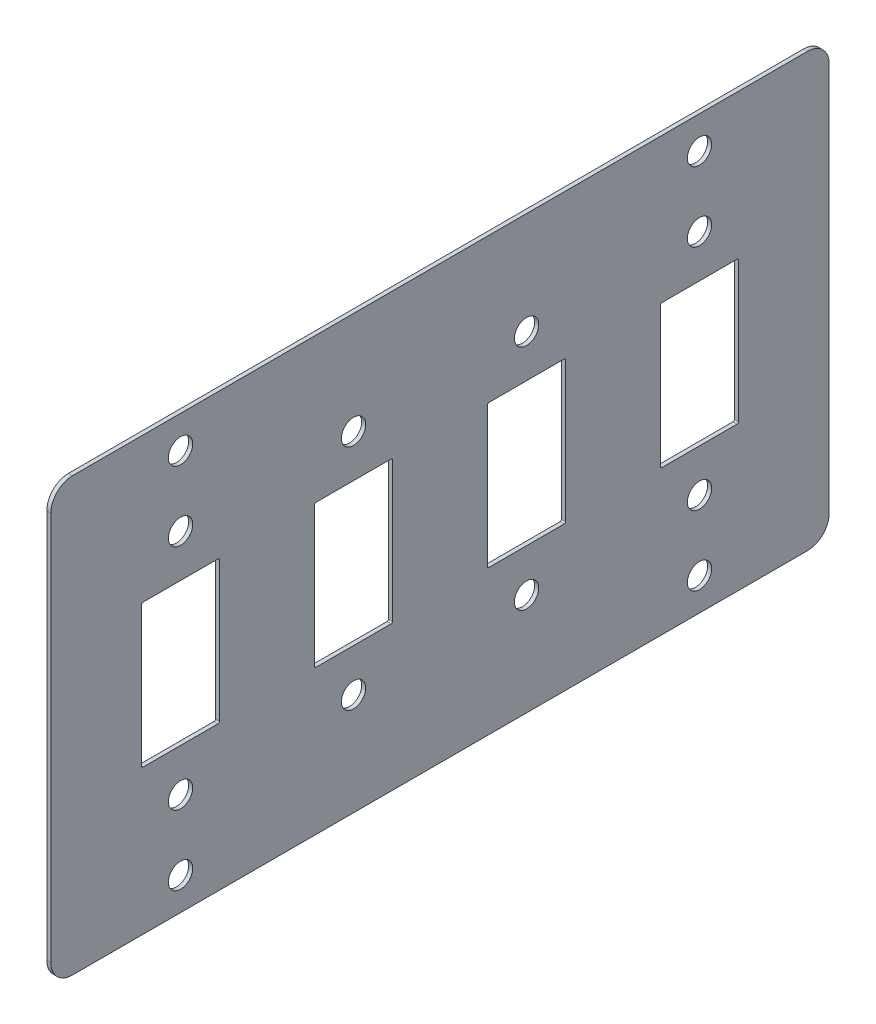
from build123d import *

# Parameters (mm, degrees)
SKETCH1_W               = 228.6
SKETCH1_H               = 127
BASE_FLANGE1_DEPTH      = 1.1938
CUT_EXTRUDE1_REACH      = 132.76
SKETCH6_R               = 3.571875
SKETCH6_W               = 22.89175
SKETCH6_H               = 41.94175
LPATTERN1_COUNT         = 4
LPATTERN1_PITCH         = 50.8
CUT_EXTRUDE2_REACH      = 132.76
SKETCH7_R               = 3.571875
MIRROR2_COPY_1_REACH    = 132.76
MIRROR2_COPY_1_SKETCH_R = 3.571875
FILLET1_R               = 6.35
FILLET2_R               = 0.396875


# Sheet-metal steps are written as plain solids
with BuildPart() as part:
    # Sketch1 → Base-Flange1 (new body)
    with BuildSketch(Plane(origin=(0, 0, 0), x_dir=(0, 0, -1), z_dir=(1, 0, 0))):
        Rectangle(SKETCH1_W, SKETCH1_H)
    extrude(amount=-BASE_FLANGE1_DEPTH)

    # Sketch6 → Cut-Extrude1 (cut, up to next)
    with BuildSketch(Plane(origin=(0, 0, 0), x_dir=(0, 0, -1), z_dir=(1, 0, 0)), mode=Mode.PRIVATE) as cut_extrude1_sk1:
        with Locations((-76.2, 33.5026)):
            Circle(SKETCH6_R)
    cut_extrude1_tool1 = extrude(cut_extrude1_sk1.sketch, amount=-CUT_EXTRUDE1_REACH, mode=Mode.PRIVATE) & part.part
    # Sketch6 → Cut-Extrude1 (cut, up to next)
    with BuildSketch(Plane(origin=(0, 0, 0), x_dir=(0, 0, -1), z_dir=(1, 0, 0)), mode=Mode.PRIVATE) as cut_extrude1_sk2:
        with Locations((-76.2, -33.5026)):
            Circle(SKETCH6_R)
    cut_extrude1_tool2 = extrude(cut_extrude1_sk2.sketch, amount=-CUT_EXTRUDE1_REACH, mode=Mode.PRIVATE) & part.part
    # Sketch6 → Cut-Extrude1 (cut, up to next)
    with BuildSketch(Plane(origin=(0, 0, 0), x_dir=(0, 0, -1), z_dir=(1, 0, 0)), mode=Mode.PRIVATE) as cut_extrude1_sk3:
        with Locations((-76.2, 0)):
            Rectangle(SKETCH6_W, SKETCH6_H)
    cut_extrude1_tool3 = extrude(cut_extrude1_sk3.sketch, amount=-CUT_EXTRUDE1_REACH, mode=Mode.PRIVATE) & part.part
    cut_extrude1_1 = cut_extrude1_tool1.solids().sort_by_distance((0, 33.5026, 76.2))[0]
    add(cut_extrude1_1, mode=Mode.SUBTRACT)
    cut_extrude1_2 = cut_extrude1_tool2.solids().sort_by_distance((0, -33.5026, 76.2))[0]
    add(cut_extrude1_2, mode=Mode.SUBTRACT)
    cut_extrude1_3 = cut_extrude1_tool3.solids().sort_by_distance((0, 0, 76.2))[0]
    add(cut_extrude1_3, mode=Mode.SUBTRACT)
    cut_extrude1 = cut_extrude1_1 + cut_extrude1_2 + cut_extrude1_3  # Cut-Extrude1 as one shape, for the pattern or mirror that repeats it

    # LPattern1: Cut-Extrude1 ×4
    with Locations(*[(0, 0, -i * LPATTERN1_PITCH) for i in range(1, LPATTERN1_COUNT)]):
        add(cut_extrude1, mode=Mode.SUBTRACT)

    # Sketch7 → Cut-Extrude2 (cut, up to next)
    with BuildSketch(Plane(origin=(0, 0, 0), x_dir=(0, 0, -1), z_dir=(1, 0, 0)), mode=Mode.PRIVATE) as cut_extrude2_sk1:
        with Locations((-76.2, 53.975)):
            Circle(SKETCH7_R)
    cut_extrude2_tool1 = extrude(cut_extrude2_sk1.sketch, amount=-CUT_EXTRUDE2_REACH, mode=Mode.PRIVATE) & part.part
    cut_extrude2 = cut_extrude2_tool1.solids().sort_by_distance((0, 53.975, 76.2))[0]
    add(cut_extrude2, mode=Mode.SUBTRACT)

    # Mirror1: Cut-Extrude2 across plane
    add(cut_extrude2.mirror(Plane.XY), mode=Mode.SUBTRACT)

    # Mirror2: Cut-Extrude2 across plane
    add(cut_extrude2.mirror(Plane.ZX), mode=Mode.SUBTRACT)

    # Mirror2 copy 1 sketch → Mirror2 copy 1 (cut, up to next)
    with BuildSketch(Plane(origin=(0, 0, 0), x_dir=(0, 0, 1), z_dir=(1, 0, 0)), mode=Mode.PRIVATE) as mirror2_copy_1_sk1:
        with Locations((-76.2, 53.975)):
            Circle(MIRROR2_COPY_1_SKETCH_R)
    mirror2_copy_1_tool1 = extrude(mirror2_copy_1_sk1.sketch, amount=-MIRROR2_COPY_1_REACH, mode=Mode.PRIVATE) & part.part
    add(mirror2_copy_1_tool1.solids().sort_by_distance((0, -53.975, -76.2))[0], mode=Mode.SUBTRACT)

    # Fillet1
    fillet1_edges = [part.edges().sort_by_distance(p)[0] for p in [
        (-0.5969, 63.5, 114.3),
        (-0.5969, 63.5, -114.3),
        (-0.5969, -63.5, -114.3),
        (-0.5969, -63.5, 114.3),
    ]]
    fillet(fillet1_edges, radius=FILLET1_R)

    # Fillet2
    fillet2_edges = [part.edges().sort_by_distance(p)[0] for p in [
        (-0.5969, 20.970875, 64.754125),
        (-0.5969, -20.970875, 64.754125),
        (-0.5969, -20.970875, 87.645875),
        (-0.5969, 20.970875, 87.645875),
        (-0.5969, 20.970875, 13.954125),
        (-0.5969, -20.970875, 13.954125),
        (-0.5969, -20.970875, 36.845875),
        (-0.5969, 20.970875, 36.845875),
        (-0.5969, -20.970875, -36.845875),
        (-0.5969, 20.970875, -36.845875),
        (-0.5969, -20.970875, -13.954125),
        (-0.5969, 20.970875, -13.954125),
        (-0.5969, -20.970875, -87.645875),
        (-0.5969, 20.970875, -87.645875),
        (-0.5969, -20.970875, -64.754125),
        (-0.5969, 20.970875, -64.754125),
    ]]
    fillet(fillet2_edges, radius=FILLET2_R)


solid = part.part
